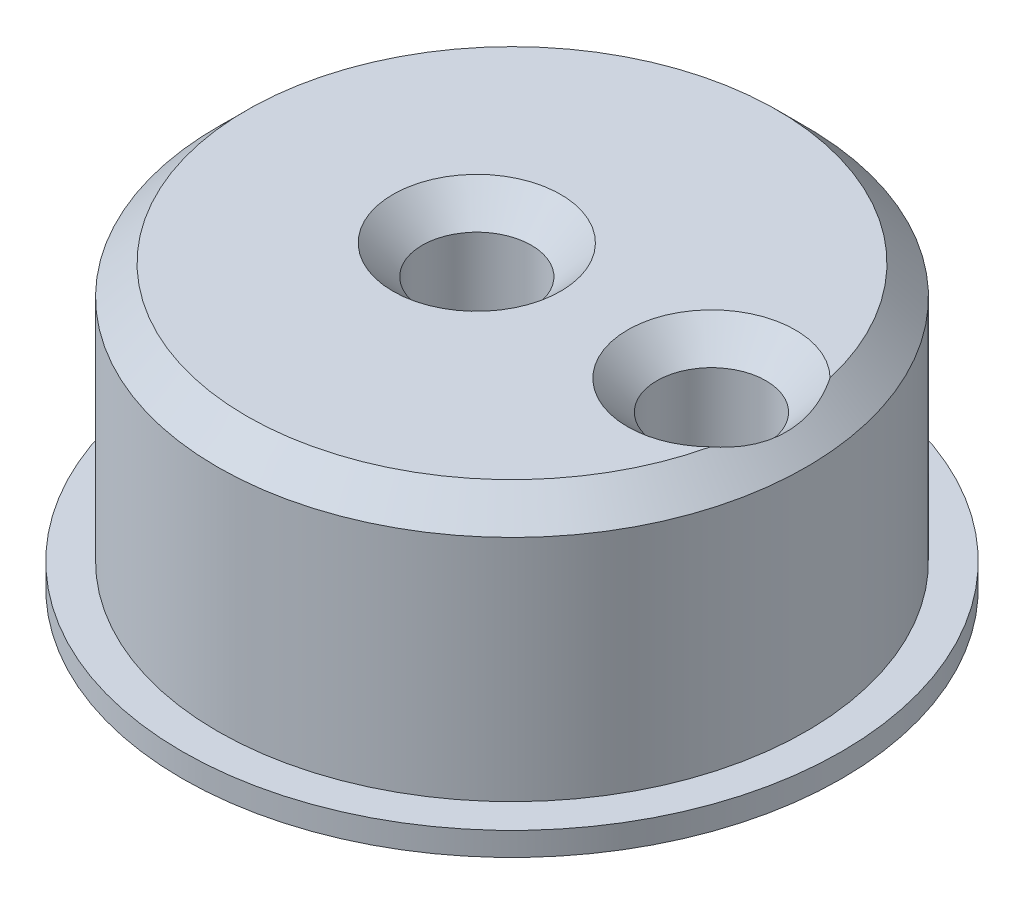
from build123d import *
from build123d.topology import SkipClean

# Parameters (mm, degrees)
SKETCH_1_R      = 5.02
SKETCH_1_R_2    = 0.93
EXTRUDE_1_DEPTH = 4.4
EXTRUDE_START   = 0.4
SKETCH_3_R      = 5.62
SKETCH_3_R_2    = 0.93
EXTRUDE_2_DEPTH = 0.4
CHAMFER_1_SIZE  = 0.5


with BuildPart() as part:
    # 草图1 → 凸台-拉伸1 (new body)
    with BuildSketch(Plane(origin=(0, 0, 0), x_dir=(1, 0, 0), z_dir=(0, 1, 0))):
        with Locations(Location((0, 0, 0), (0, 0, 270))):
            Circle(SKETCH_1_R)
        with Locations(Location((3.4, 0, 0), (0, 0, 270))):
            Circle(SKETCH_1_R_2, mode=Mode.SUBTRACT)
        with Locations(Location((-0.6, 0, 0), (0, 0, 90))):
            Circle(SKETCH_1_R_2, mode=Mode.SUBTRACT)
    extrude(amount=EXTRUDE_1_DEPTH)

    # 草图3 → 凸台-拉伸2 (add)
    with SkipClean():  # the faces are left unmerged after this step: merging them gives an invalid solid
        with BuildSketch(Plane.XZ.offset(EXTRUDE_START)):
            with Locations(Location((0, 0, 0), (0, 0, 270))):
                Circle(SKETCH_3_R)
            with Locations(Location((3.4, 0, 0), (0, 0, 270))):
                Circle(SKETCH_3_R_2, mode=Mode.SUBTRACT)
            with Locations(Location((-0.6, 0, 0), (0, 0, 270))):
                Circle(SKETCH_3_R_2, mode=Mode.SUBTRACT)
        extrude(amount=-EXTRUDE_2_DEPTH)

    # 倒角1
    # the kernel refuses this chamfer: 0.5 mm, written as the material it takes off along each edge
    with BuildSketch(Plane(origin=(3.4, -0.4, 0), x_dir=(0, 0, -1), z_dir=(-1, 0, 0))) as chamfer_1_piece_1:
        Polygon((0.93 + CHAMFER_1_SIZE, 0), (0.93, -CHAMFER_1_SIZE), (0.93, 0), align=None)
    revolve(axis=Axis((3.4, -0.4, 0), (0, -1, 0)), mode=Mode.SUBTRACT)
    with BuildSketch(Plane(origin=(-0.6, -0.4, 0), x_dir=(0, 0, -1), z_dir=(-1, 0, 0))) as chamfer_1_piece_2:
        Polygon((0.93 + CHAMFER_1_SIZE, 0), (0.93, -CHAMFER_1_SIZE), (0.93, 0), align=None)
    revolve(axis=Axis((-0.6, -0.4, 0), (0, -1, 0)), mode=Mode.SUBTRACT)
    with BuildSketch(Plane(origin=(0, 4.4, 0), x_dir=(0, 0, 1), z_dir=(-1, 0, 0))) as chamfer_1_piece_3:
        Polygon((5.02, -CHAMFER_1_SIZE), (5.02 - CHAMFER_1_SIZE, 0), (5.02, 0), align=None)
    revolve(axis=Axis((0, 4.4, 0), (0, 1, 0)), mode=Mode.SUBTRACT)
    with BuildSketch(Plane(origin=(3.4, 4.4, 0), x_dir=(0, 0, 1), z_dir=(-1, 0, 0))) as chamfer_1_piece_4:
        Polygon((0.93 + CHAMFER_1_SIZE, 0), (0.93, -CHAMFER_1_SIZE), (0.93, 0), align=None)
    revolve(axis=Axis((3.4, 4.4, 0), (0, 1, 0)), mode=Mode.SUBTRACT)
    with BuildSketch(Plane(origin=(-0.6, 4.4, 0), x_dir=(0, 0, -1), z_dir=(1, 0, 0))) as chamfer_1_piece_5:
        Polygon((0.93 + CHAMFER_1_SIZE, 0), (0.93, -CHAMFER_1_SIZE), (0.93, 0), align=None)
    revolve(axis=Axis((-0.6, 4.4, 0), (0, 1, 0)), mode=Mode.SUBTRACT)


solid = part.part
